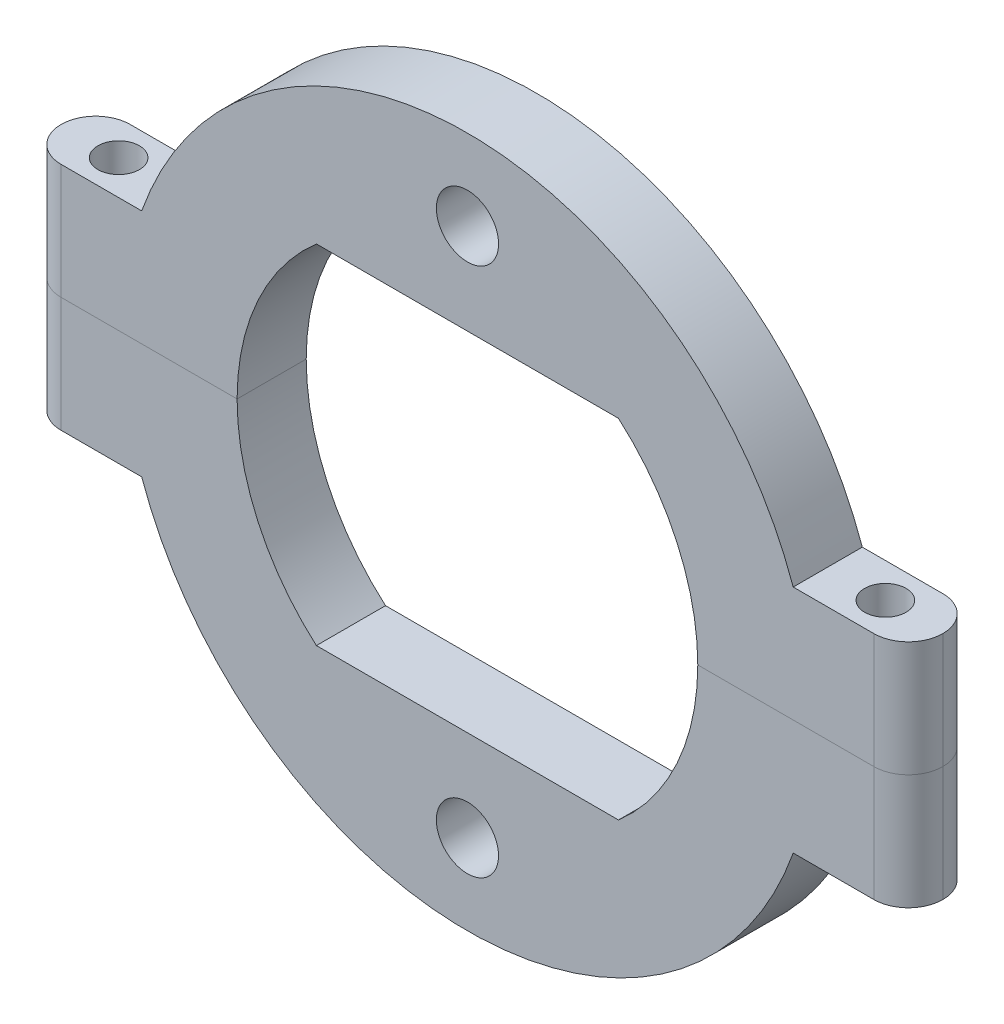
from build123d import *

# Parameters (mm, degrees)
SKETCH1_R           = 15
SKETCH1_R_2         = 10
BOSS_EXTRUDE1_DEPTH = 3
SKETCH2_R           = 0.9
CUT_EXTRUDE1_DEPTH  = 28.846388567
SKETCH3_R           = 1.35
CUT_EXTRUDE2_DEPTH  = 25.503496817
FILLET2_R           = 1.5


with BuildPart() as part:
    # Sketch1 → Boss-Extrude1 (new body)
    # profile 1 of 7: a face of its own
    with BuildSketch(Plane.XY):
        Circle(SKETCH1_R)
        Circle(SKETCH1_R_2, mode=Mode.SUBTRACT)
    # profile 2 of 7: a face of its own
    with BuildSketch(Plane.XY):
        with BuildLine():
            ThreePointArc((6.557247898, 7.55), (0, 10), (-6.557247898, 7.55))
            Line((-6.557247898, 7.55), (6.557247898, 7.55))
        make_face()
    # profile 3 of 7: a face of its own
    with BuildSketch(Plane.XY):
        with BuildLine():
            Line((6.557247898, -7.55), (-6.557247898, -7.55))
            ThreePointArc((-6.557247898, -7.55), (0, -10), (6.557247898, -7.55))
        make_face()
    # profile 4 of 7: a face of its own
    with BuildSketch(Plane.XY):
        with BuildLine():
            Line((19.142135624, 5), (14.142135624, 5))
            ThreePointArc((14.142135624, 5), (14.783978395, 2.536529681), (15, 0))
            ThreePointArc((15, 0), (14.783978395, -2.536529681), (14.142135624, -5))
            Line((14.142135624, -5), (19.142135624, -5))
            Line((19.142135624, -5), (19.142135624, 5))
        make_face()
    # profile 5 of 7: a face of its own
    with BuildSketch(Plane.XY):
        with BuildLine():
            ThreePointArc((15, 0), (14.783978395, 2.536529681), (14.142135624, 5))
            Line((14.142135624, 5), (14.142135624, -5))
            ThreePointArc((14.142135624, -5), (14.783978395, -2.536529681), (15, 0))
        make_face()
    # profile 6 of 7: a face of its own
    with BuildSketch(Plane.XY):
        with BuildLine():
            Line((-14.142135624, -5), (-14.142135624, 5))
            ThreePointArc((-14.142135624, 5), (-15, 0), (-14.142135624, -5))
        make_face()
    # profile 7 of 7: a face of its own
    with BuildSketch(Plane.XY):
        with BuildLine():
            ThreePointArc((-14.142135624, -5), (-15, 0), (-14.142135624, 5))
            Line((-14.142135624, 5), (-19.142135624, 5))
            Line((-19.142135624, 5), (-19.142135624, -5))
            Line((-19.142135624, -5), (-14.142135624, -5))
        make_face()
    extrude(amount=BOSS_EXTRUDE1_DEPTH)

    # Sketch2 → Cut-Extrude1 (cut, through all)
    with BuildSketch(Plane.XZ.offset(5)):
        with Locations((16.642135624, 1.5)):
            Circle(SKETCH2_R)
    cut_extrude1 = extrude(amount=-CUT_EXTRUDE1_DEPTH, mode=Mode.SUBTRACT)

    # Mirror1: Cut-Extrude1 across plane
    add(cut_extrude1.mirror(Plane(origin=(0, 0, 0), x_dir=(0, 0, 1), z_dir=(1, 0, 0))), mode=Mode.SUBTRACT)

    # Sketch3 → Cut-Extrude2 (cut, through all)
    with BuildSketch(Plane.XY.offset(3)):
        with Locations((0, 11.5)):
            Circle(SKETCH3_R)
        with Locations(Location((0, -11.5, 0), (0, 0, 180))):
            Circle(SKETCH3_R)
    extrude(amount=-CUT_EXTRUDE2_DEPTH, mode=Mode.SUBTRACT)

    # Fillet2
    fillet2_edges = [part.edges().sort_by_distance(p)[0] for p in [
        (19.142135624, 0, 3),
        (19.142135624, 0, 0),
        (-19.142135624, 0, 3),
        (-19.142135624, 0, 0),
    ]]
    fillet(fillet2_edges, radius=FILLET2_R - 0.0001)  # a hair under: the kernel refuses the full size


with BuildPart() as body_2:
    # Split1: the piece on the far side of the plane
    add(part.part)
    split(bisect_by=Plane.ZX, keep=Keep.BOTTOM)


with BuildPart() as part_1:
    add(part.part)

    # Split1
    split(bisect_by=Plane.ZX, keep=Keep.TOP)


solid = Compound([body_2.part, part_1.part])
